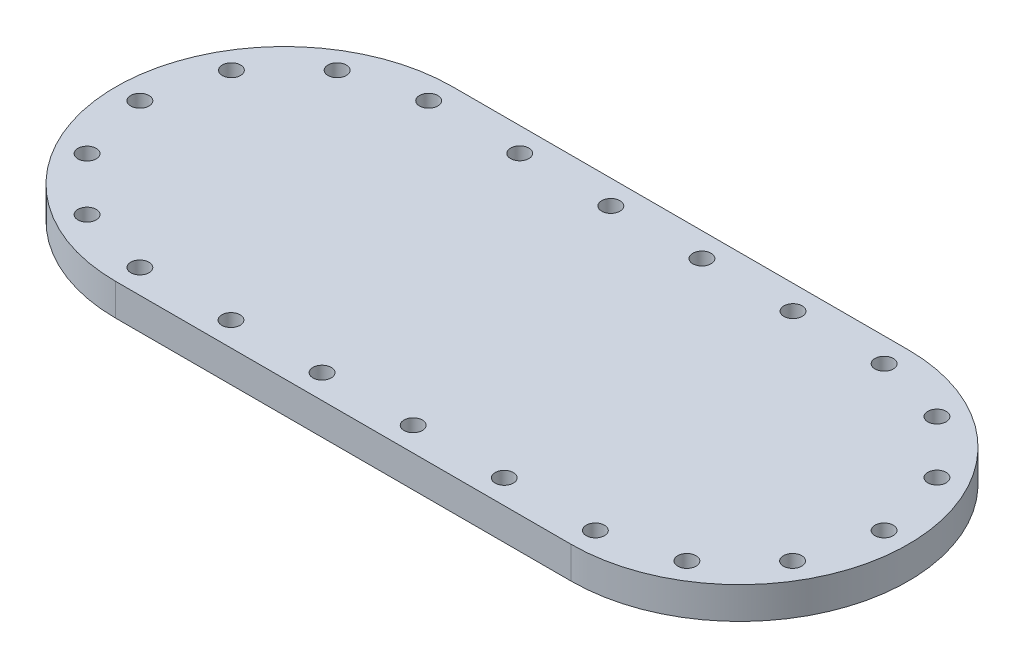
from build123d import *

# Parameters (mm, degrees)
BOSS_EXTRUDE1_DEPTH = 8.89
SKETCH4_R           = 2.5527
CUT_EXTRUDE1_DEPTH  = 121.395732067


with BuildPart() as part:
    # Sketch1 → Boss-Extrude1 (new body)
    with BuildSketch(Plane(origin=(0, 0, 0), x_dir=(1, 0, 0), z_dir=(0, 1, 0))):
        with BuildLine():
            Line((63.5, 46.99), (-63.5, 46.99))
            ThreePointArc((-63.5, 46.99), (-110.49, 0), (-63.5, -46.99))
            Line((-63.5, -46.99), (63.5, -46.99))
            ThreePointArc((63.5, -46.99), (110.49, 0), (63.5, 46.99))
        make_face()
    extrude(amount=BOSS_EXTRUDE1_DEPTH)

    # Sketch4 → Cut-Extrude1 (cut, through all)
    with BuildSketch(Plane.XZ):
        with Locations((83.6295, -34.865316731)):
            Circle(SKETCH4_R)
        with Locations((63.5, -40.259)):
            Circle(SKETCH4_R)
        with Locations((38.1, -40.259)):
            Circle(SKETCH4_R)
        with Locations((12.7, -40.259)):
            Circle(SKETCH4_R)
        with Locations((-12.7, -40.259)):
            Circle(SKETCH4_R)
        with Locations((-38.1, -40.259)):
            Circle(SKETCH4_R)
        with Locations((-63.5, -40.259)):
            Circle(SKETCH4_R)
        with Locations((-83.6295, -34.865316731)):
            Circle(SKETCH4_R)
        with Locations((-98.365316731, -20.1295)):
            Circle(SKETCH4_R)
        with Locations((-103.759, 0)):
            Circle(SKETCH4_R)
        with Locations((-98.365316731, 20.1295)):
            Circle(SKETCH4_R)
        with Locations((-83.6295, 34.865316731)):
            Circle(SKETCH4_R)
        with Locations((-63.5, 40.259)):
            Circle(SKETCH4_R)
        with Locations((-38.1, 40.259)):
            Circle(SKETCH4_R)
        with Locations((-12.7, 40.259)):
            Circle(SKETCH4_R)
        with Locations((12.7, 40.259)):
            Circle(SKETCH4_R)
        with Locations((38.1, 40.259)):
            Circle(SKETCH4_R)
        with Locations((63.5, 40.259)):
            Circle(SKETCH4_R)
        with Locations((83.6295, 34.865316731)):
            Circle(SKETCH4_R)
        with Locations((98.365316731, 20.1295)):
            Circle(SKETCH4_R)
        with Locations((103.759, 0)):
            Circle(SKETCH4_R)
        with Locations((98.365316731, -20.1295)):
            Circle(SKETCH4_R)
    extrude(amount=-CUT_EXTRUDE1_DEPTH, mode=Mode.SUBTRACT)


solid = part.part
